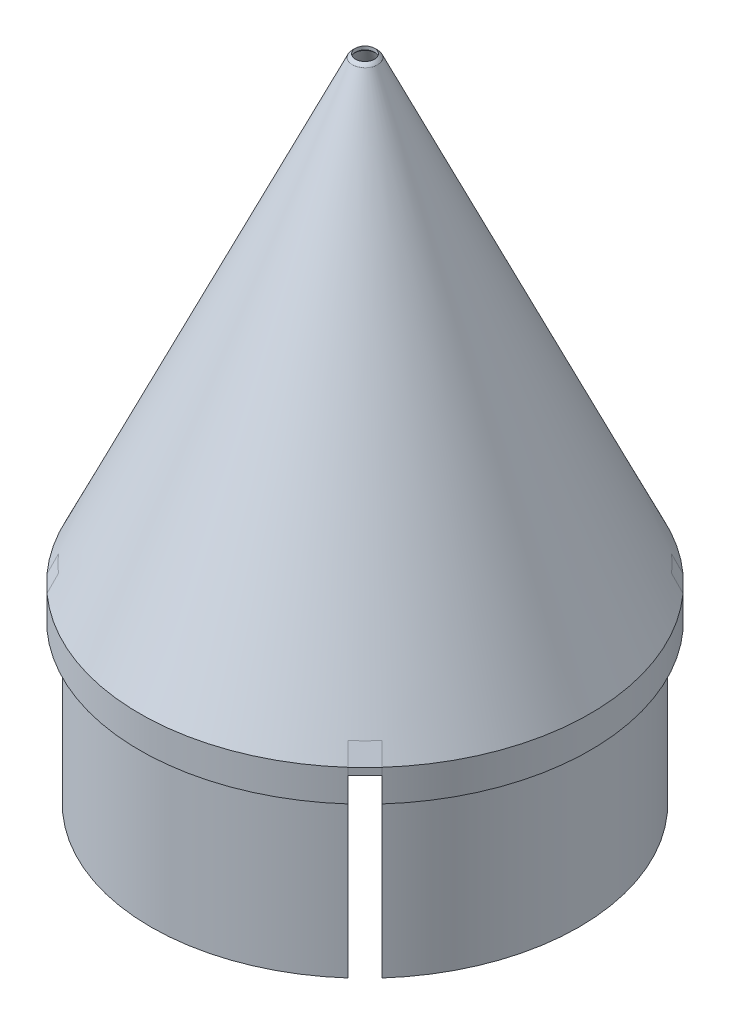
from build123d import *

# Parameters (mm, degrees)
SHELL1_T            = -0.8
SKETCH7_R           = 3
CUT_EXTRUDE3_DEPTH  = 186.253539274
BOSS_EXTRUDE1_DEPTH = 7.5
CUT_EXTRUDE4_DEPTH  = 1.75
CIRPATTERN1_COUNT   = 2
BOSS_EXTRUDE3_DEPTH = 10
CUT_EXTRUDE8_DEPTH  = 65.5
SKETCH17_R          = 0.25
BOSS_EXTRUDE4_DEPTH = 1.25
BOSS_EXTRUDE7_START = -6.25
BOSS_EXTRUDE7_DEPTH = 6.25
CUT_EXTRUDE9_REACH  = 192.044
SKETCH21_R          = 2.8
SKETCH22_R          = 4.75
SKETCH22_R_2        = 2.8
BOSS_EXTRUDE8_DEPTH = 4
SKETCH23_R          = 4.75
SKETCH23_R_2        = 2.3
BOSS_EXTRUDE9_DEPTH = 2
CIRPATTERN4_COUNT   = 4
BOSS_EXTRUDE6_REACH = 190.07
CIRPATTERN8_COUNT   = 4


with BuildPart() as part:
    # Sketch3 → Revolve1 (revolve)
    with BuildSketch(Plane.XY):
        with BuildLine():
            Line((0, 0), (0, 155.681963674))
            ThreePointArc((0, 155.681963674), (2.236067977, 155.154099629), (4, 153.681963674))
            Line((4, 153.681963674), (71, 10))
            Line((71, 10), (71, 0))
            Line((71, 0), (67.5, 0))
            Line((67.5, 0), (67.5, -50))
            Line((67.5, -50), (0, -50))
            Line((0, -50), (0, 0))
        make_face()
    revolve(axis=Axis((0, 0, 0), (0, 1, 0)))

    # Shell1
    shell1_openings = [part.faces().sort_by_distance(p)[0] for p in [
        (0, -50, 0),
    ]]
    offset(amount=SHELL1_T, openings=shell1_openings, kind=Kind.INTERSECTION)

    # Sketch7 → Cut-Extrude3 (cut, through all)
    with BuildSketch(Plane(origin=(0, 0, 0), x_dir=(1, 0, 0), z_dir=(0, 1, 0))):
        Circle(SKETCH7_R)
    extrude(amount=CUT_EXTRUDE3_DEPTH, mode=Mode.SUBTRACT)

    # Sketch8 → Boss-Extrude1 (add, symmetric)
    with BuildSketch(Plane(origin=(0, 0, 0), x_dir=(0, 0, -1), z_dir=(1, 0, 0))):
        Polygon((-39.806982196, 40.909925586), (-39.806982196, 35.909925586), (-44.806982196, 34.090074414), (-58.88391148, 34.090074414), (-44.806982196, 64.278146683), (-44.806982196, 44.090074414), (-44.806982196, 39.090074414), align=None)
    boss_extrude1 = extrude(amount=BOSS_EXTRUDE1_DEPTH, both=True)

    # Sketch9 → Cut-Extrude4 (cut, symmetric)
    with BuildSketch(Plane(origin=(0, 0, 0), x_dir=(0, 0, -1), z_dir=(1, 0, 0))):
        Polygon((-44.806982196, 39.090074414), (-44.806982196, 62.941354839), (-58.88391148, 34.090074414), (-44.806982196, 34.090074414), (-39.806982196, 35.909925586), (-39.806982196, 40.909925586), align=None)
    cut_extrude4 = extrude(amount=CUT_EXTRUDE4_DEPTH, both=True, mode=Mode.SUBTRACT)

    # CirPattern1: Boss-Extrude1, Cut-Extrude4 ×2 about axis
    cirpattern1_axis = Axis((0, 0, 0), (0, -1, 0))
    add([boss_extrude1.rotate(cirpattern1_axis, i * 360 / CIRPATTERN1_COUNT) for i in range(1, CIRPATTERN1_COUNT)])
    add([cut_extrude4.rotate(cirpattern1_axis, i * 360 / CIRPATTERN1_COUNT) for i in range(1, CIRPATTERN1_COUNT)], mode=Mode.SUBTRACT)

    # Sketch11 → Boss-Extrude3 (add, symmetric)
    with BuildSketch(Plane(origin=(0, 0, 0), x_dir=(0, -1, 0), z_dir=(0.707106781186552, 0, 0.7071067811865431))):
        with BuildLine():
            Line((-15.360916844, 53.7), (-15.360916844, 67.386877254))
            Line((-15.360916844, 67.386877254), (-9.82264427, 70.2))
            Line((-9.82264427, 70.2), (-0.8, 70.2))
            Line((-0.8, 70.2), (-0.8, 66.7))
            Line((-0.8, 66.7), (-0.8, 53.7))
            ThreePointArc((-0.8, 53.7), (-8.080458422, 46.419541578), (-15.360916844, 53.7))
        make_face()
    boss_extrude3 = extrude(amount=BOSS_EXTRUDE3_DEPTH, both=True)

    # Sketch13 → Cut-Extrude8 (cut)
    with BuildSketch(Plane.XZ.offset(50)):
        with BuildLine():
            Line((30.1719222, -35.475223059), (35.475223059, -30.1719222))
            Line((35.475223059, -30.1719222), (52.786157009, -47.48285615))
            ThreePointArc((52.786157009, -47.48285615), (50.204581464, -50.204581464), (47.48285615, -52.786157009))
            Line((47.48285615, -52.786157009), (30.1719222, -35.475223059))
        make_face()
    cut_extrude8 = extrude(amount=-CUT_EXTRUDE8_DEPTH, mode=Mode.SUBTRACT)

    # Sketch15 → M4 Clearance Hole1 (revolve, cut)
    with BuildSketch(Plane(origin=(45.042701962, 8.080458422, -30.900566338), x_dir=(0.7071067811865432, 0, -0.7071067811865519), z_dir=(0, 1, 0))):
        Polygon((0, 0), (0, 21.442065486), (2.4, 20), (2.4, 0), align=None)
    m4_clearance_hole1 = revolve(axis=Axis((49.532830022, 8.080458422, -26.410438277), (-0.7071067811865519, 0, -0.7071067811865432)), mode=Mode.SUBTRACT)

    # Sketch17 → Boss-Extrude4 (add, symmetric)
    with BuildSketch(Plane(origin=(0, 0, 0), x_dir=(0, -1, 0), z_dir=(0.707106781186552, 0, 0.7071067811865431))):
        with BuildLine():
            Line((-48.989198727, 51.936335713), (-47.176583153, 52.781572237))
            Line((-47.176583153, 52.781572237), (-46.260601823, 50.817243936))
            ThreePointArc((-46.260601823, 50.817243936), (-46.744291348, 49.488317887), (-48.073217397, 49.972007412))
            Line((-48.073217397, 49.972007412), (-48.989198727, 51.936335713))
        make_face()
        with Locations((-47.16690961, 50.394625674)):
            Circle(SKETCH17_R, mode=Mode.SUBTRACT)
    boss_extrude4 = extrude(amount=BOSS_EXTRUDE4_DEPTH, both=True)

    # Sketch19 → Boss-Extrude7 (add)
    with BuildSketch(Plane(origin=(-7.071067812, 0, -7.071067812), x_dir=(-0.7071067811865432, 0, 0.7071067811865519), z_dir=(-0.7071067811865519, 0, -0.7071067811865432)).offset(BOSS_EXTRUDE7_START)):
        with BuildLine():
            Line((-44.7, 12.830458422), (-48.182520971, 12.830458422))
            ThreePointArc((-48.182520971, 12.830458422), (-46.419541578, 8.080458422), (-48.182520971, 3.330458422))
            Line((-48.182520971, 3.330458422), (-44.7, 3.330458422))
            ThreePointArc((-44.7, 3.330458422), (-39.95, 8.080458422), (-44.7, 12.830458422))
        make_face()
    boss_extrude7 = extrude(amount=BOSS_EXTRUDE7_DEPTH)

    # Sketch21 → Cut-Extrude9 (cut, up to next)
    with BuildSketch(Plane(origin=(-7.071067812, 0, -7.071067812), x_dir=(-0.7071067811865432, 0, 0.7071067811865519), z_dir=(-0.7071067811865519, 0, -0.7071067811865432)), mode=Mode.PRIVATE) as cut_extrude9_sk1:
        with Locations((-44.7, 8.080458422)):
            Circle(SKETCH21_R)
    cut_extrude9_tool1 = extrude(cut_extrude9_sk1.sketch, amount=-CUT_EXTRUDE9_REACH, mode=Mode.PRIVATE) & part.part
    cut_extrude9 = cut_extrude9_tool1.solids().sort_by_distance((24.536605, 8.080458, -38.678741))[0]
    add(cut_extrude9, mode=Mode.SUBTRACT)

    # Sketch22 → Boss-Extrude8 (add)
    with BuildSketch(Plane(origin=(-7.071067812, 0, -7.071067812), x_dir=(-0.7071067811865432, 0, 0.7071067811865519), z_dir=(-0.7071067811865519, 0, -0.7071067811865432))):
        with Locations((-44.7, 8.080458422)):
            Circle(SKETCH22_R)
        with Locations((-44.7, 8.080458422)):
            Circle(SKETCH22_R_2, mode=Mode.SUBTRACT)
    boss_extrude8 = extrude(amount=BOSS_EXTRUDE8_DEPTH)

    # Sketch23 → Boss-Extrude9 (add)
    with BuildSketch(Plane(origin=(-9.899494937, 0, -9.899494937), x_dir=(-0.7071067811865434, 0, 0.7071067811865517), z_dir=(-0.7071067811865517, 0, -0.7071067811865434))):
        with Locations((-44.7, 8.080458422)):
            Circle(SKETCH23_R)
        with Locations((-44.7, 8.080458422)):
            Circle(SKETCH23_R_2, mode=Mode.SUBTRACT)
    boss_extrude9 = extrude(amount=BOSS_EXTRUDE9_DEPTH)

    # CirPattern4: Boss-Extrude3, Cut-Extrude8, M4 Clearance Hole1, Boss-Extrude4, Boss-Extrude7, Cut-Extrude9, Boss-Extrude8, Boss-Extrude9 ×4 about axis
    cirpattern4_axis = Axis((0, 0, 0), (0, -1, 0))
    add([boss_extrude3.rotate(cirpattern4_axis, i * 360 / CIRPATTERN4_COUNT) for i in range(1, CIRPATTERN4_COUNT)])
    add([cut_extrude8.rotate(cirpattern4_axis, i * 360 / CIRPATTERN4_COUNT) for i in range(1, CIRPATTERN4_COUNT)], mode=Mode.SUBTRACT)
    add([m4_clearance_hole1.rotate(cirpattern4_axis, i * 360 / CIRPATTERN4_COUNT) for i in range(1, CIRPATTERN4_COUNT)], mode=Mode.SUBTRACT)
    add([boss_extrude4.rotate(cirpattern4_axis, i * 360 / CIRPATTERN4_COUNT) for i in range(1, CIRPATTERN4_COUNT)])
    add([boss_extrude7.rotate(cirpattern4_axis, i * 360 / CIRPATTERN4_COUNT) for i in range(1, CIRPATTERN4_COUNT)])
    add([cut_extrude9.rotate(cirpattern4_axis, i * 360 / CIRPATTERN4_COUNT) for i in range(1, CIRPATTERN4_COUNT)], mode=Mode.SUBTRACT)
    add([boss_extrude8.rotate(cirpattern4_axis, i * 360 / CIRPATTERN4_COUNT) for i in range(1, CIRPATTERN4_COUNT)])
    add([boss_extrude9.rotate(cirpattern4_axis, i * 360 / CIRPATTERN4_COUNT) for i in range(1, CIRPATTERN4_COUNT)])

    # Sketch18 → Boss-Extrude6 (add, up to next)
    with BuildSketch(Plane(origin=(1.944543648, 0, -7.247844507), x_dir=(0.7071067811865437, 0, -0.7071067811865513), z_dir=(0.7071067811865513, 0, 0.7071067811865437)), mode=Mode.PRIVATE) as boss_extrude6_sk1:
        with BuildLine():
            Line((61.832487622, 15.5), (64.400899148, 10))
            Line((64.400899148, 10), (64.400899148, 7.805634816))
            Line((64.400899148, 7.805634816), (62.58432966, 9.97053803))
            ThreePointArc((62.58432966, 9.97053803), (62.166779573, 12.853725749), (60.948439685, 15.5))
            Line((60.948439685, 15.5), (61.832487622, 15.5))
        make_face()
    boss_extrude6_tool1 = extrude(boss_extrude6_sk1.sketch, amount=BOSS_EXTRUDE6_REACH, mode=Mode.PRIVATE) - part.part
    boss_extrude6 = boss_extrude6_tool1.solids().sort_by_distance((46.496587, 11.546485, -51.799888))[0]
    add(boss_extrude6)

    # CirPattern8: Boss-Extrude6 ×4 about axis
    cirpattern8_axis = Axis((0, 0, 0), (0, -1, 0))
    for i in range(1, CIRPATTERN8_COUNT):
        add(boss_extrude6.rotate(cirpattern8_axis, i * 360 / CIRPATTERN8_COUNT))


solid = part.part
